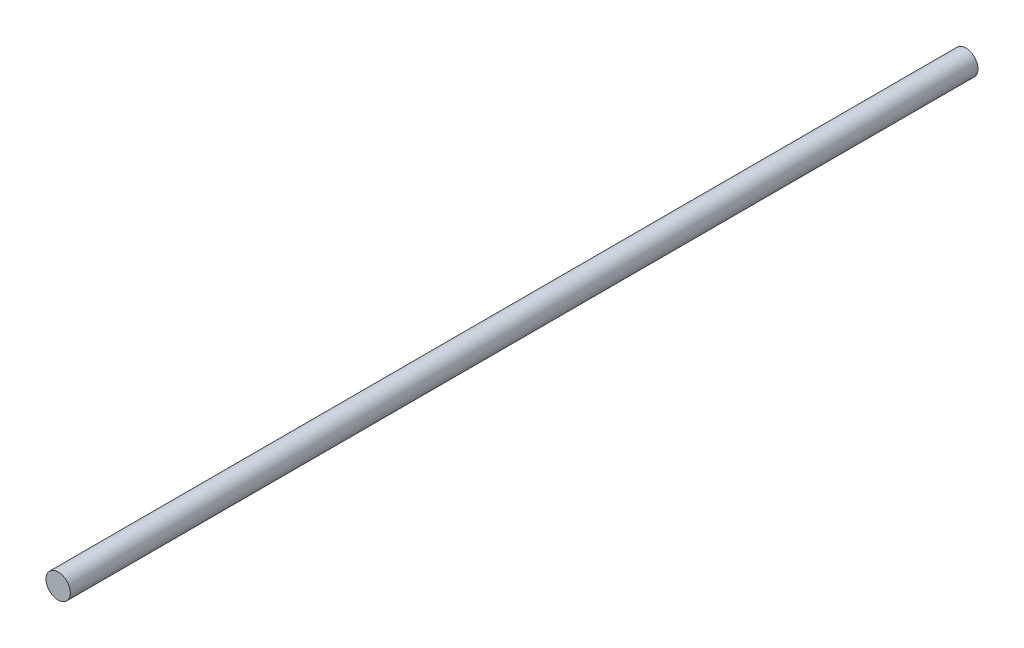
from build123d import *

# Parameters (mm, degrees)
SKETCH1_R           = 5
BOSS_EXTRUDE1_DEPTH = 373


with BuildPart() as part:
    # Sketch1 → Boss-Extrude1 (new body)
    with BuildSketch(Plane.XY):
        Circle(SKETCH1_R)
    extrude(amount=BOSS_EXTRUDE1_DEPTH)


solid = part.part
